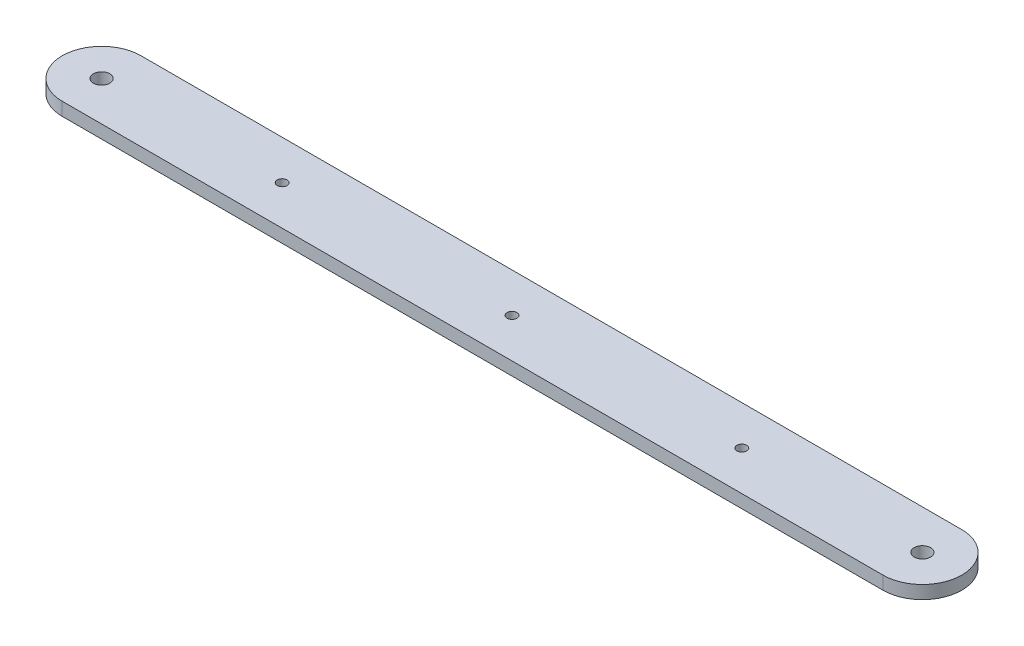
from build123d import *

# Parameters (mm, degrees)
SKETCH_1_R          = 2.5
EXTRUDE_1_DEPTH     = 4
SKETCH_2_R          = 1.5
CUT_EXTRUDE_1_DEPTH = 4


with BuildPart() as part:
    # 草图1 → 凸台-拉伸1 (new body)
    with BuildSketch(Plane(origin=(0, 0, 0), x_dir=(1, 0, 0), z_dir=(0, 1, 0))):
        with BuildLine():
            Line((-125, 12), (125, 12))
            ThreePointArc((125, 12), (137, 0), (125, -12))
            Line((125, -12), (-125, -12))
            ThreePointArc((-125, -12), (-137, 0), (-125, 12))
        make_face()
        with Locations((125, 0)):
            Circle(SKETCH_1_R, mode=Mode.SUBTRACT)
        with Locations((-125, 0)):
            Circle(SKETCH_1_R, mode=Mode.SUBTRACT)
    extrude(amount=EXTRUDE_1_DEPTH)

    # 草图2 → 切除-拉伸1 (cut)
    with BuildSketch(Plane.XZ):
        with Locations((-70, 0)):
            Circle(SKETCH_2_R)
        Circle(SKETCH_2_R)
        with Locations((70, 0)):
            Circle(SKETCH_2_R)
    extrude(amount=-CUT_EXTRUDE_1_DEPTH, mode=Mode.SUBTRACT)


solid = part.part
